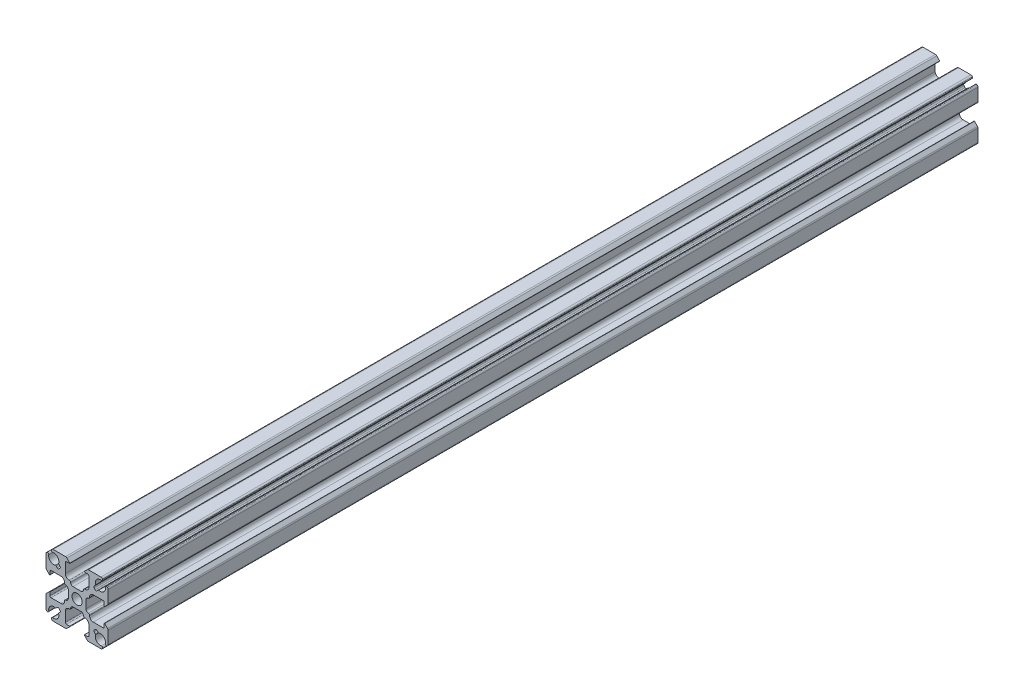
from build123d import *

# Parameters (mm, degrees)
SKETCH1_R                           = 2.08
BOSS_EXTRUDE1_DEPTH                 = 177.8
SKETCH2_W                           = 3.2
SKETCH2_H                           = 16.3
F_6_4_6_4_DIAMETER_HOLE1_AT_2_COUNT = 2
F_6_4_6_4_DIAMETER_HOLE1_AT_2_PITCH = 120
F_6_4_6_4_DIAMETER_HOLE1_AT_3_COUNT = 2
F_6_4_6_4_DIAMETER_HOLE1_AT_3_PITCH = 240


with BuildPart() as part:
    # Sketch1 → Boss-Extrude1 (new, symmetric)
    with BuildSketch(Plane(origin=(0, 0, 0), x_dir=(-1, 0, 0), z_dir=(0, 0, -1))):
        with BuildLine():
            Line((-7.48853247, 8.61990332), (-6.985643798, 8.117014648))
            ThreePointArc((-6.985643798, 8.117014648), (-6.839197188, 7.763461257), (-6.985643798, 7.409907866))
            Line((-6.985643798, 7.409907866), (-7.409907866, 6.985643798))
            ThreePointArc((-7.409907866, 6.985643798), (-7.763461257, 6.839197188), (-8.117014648, 6.985643798))
            Line((-8.117014648, 6.985643798), (-8.61990332, 7.48853247))
            ThreePointArc((-8.61990332, 7.48853247), (-8.738774884, 7.554957329), (-8.874825936, 7.549228331))
            ThreePointArc((-8.874825936, 7.549228331), (-10.889377278, 7.955008076), (-11.572136222, 9.893284252))
            ThreePointArc((-11.572136222, 9.893284252), (-11.766795458, 10.383720777), (-12.292708824, 10.42656157))
            ThreePointArc((-12.292708824, 10.42656157), (-12.590129525, 10.150252615), (-12.7, 9.759440396))
            Line((-12.7, 9.759440396), (-12.7, 4.710660172))
            ThreePointArc((-12.7, 4.710660172), (-12.642909649, 4.423647598), (-12.480330086, 4.180330086))
            Line((-12.480330086, 4.180330086), (-11.270710678, 2.970710678))
            ThreePointArc((-11.270710678, 2.970710678), (-11.161731657, 2.949033403), (-11.1, 3.041421356))
            Line((-11.1, 3.041421356), (-11.1, 4.325))
            ThreePointArc((-11.1, 4.325), (-10.953553391, 4.678553391), (-10.6, 4.825))
            Line((-10.6, 4.825), (-6.6, 4.825))
            ThreePointArc((-6.6, 4.825), (-5.539339828, 4.385660172), (-5.1, 3.325))
            Line((-5.1, 3.325), (-5.1, 3.15))
            ThreePointArc((-5.1, 3.15), (-4.953553391, 2.796446609), (-4.6, 2.65))
            ThreePointArc((-4.6, 2.65), (-3.892893219, 2.357106781), (-3.6, 1.65))
            Line((-3.6, 1.65), (-3.6, -1.65))
            ThreePointArc((-3.6, -1.65), (-3.892893219, -2.357106781), (-4.6, -2.65))
            ThreePointArc((-4.6, -2.65), (-4.953553391, -2.796446609), (-5.1, -3.15))
            Line((-5.1, -3.15), (-5.1, -3.325))
            ThreePointArc((-5.1, -3.325), (-5.539339828, -4.385660172), (-6.6, -4.825))
            Line((-6.6, -4.825), (-10.6, -4.825))
            ThreePointArc((-10.6, -4.825), (-10.953553391, -4.678553391), (-11.1, -4.325))
            Line((-11.1, -4.325), (-11.1, -3.041421356))
            ThreePointArc((-11.1, -3.041421356), (-11.161731657, -2.949033403), (-11.270710678, -2.970710678))
            Line((-11.270710678, -2.970710678), (-12.480330086, -4.180330086))
            ThreePointArc((-12.480330086, -4.180330086), (-12.642909649, -4.423647598), (-12.7, -4.710660172))
            Line((-12.7, -4.710660172), (-12.7, -9.759440396))
            ThreePointArc((-12.7, -9.759440396), (-12.590129525, -10.150252615), (-12.292708824, -10.42656157))
            ThreePointArc((-12.292708824, -10.42656157), (-11.766795458, -10.383720777), (-11.572136222, -9.893284252))
            ThreePointArc((-11.572136222, -9.893284252), (-10.889377278, -7.955008076), (-8.874825936, -7.549228331))
            ThreePointArc((-8.874825936, -7.549228331), (-8.738774884, -7.554957329), (-8.61990332, -7.48853247))
            Line((-8.61990332, -7.48853247), (-8.117014648, -6.985643798))
            ThreePointArc((-8.117014648, -6.985643798), (-7.763461257, -6.839197188), (-7.409907866, -6.985643798))
            Line((-7.409907866, -6.985643798), (-6.985643798, -7.409907866))
            ThreePointArc((-6.985643798, -7.409907866), (-6.839197188, -7.763461257), (-6.985643798, -8.117014648))
            Line((-6.985643798, -8.117014648), (-7.48853247, -8.61990332))
            ThreePointArc((-7.48853247, -8.61990332), (-7.554957329, -8.738774884), (-7.549228331, -8.874825936))
            ThreePointArc((-7.549228331, -8.874825936), (-7.955008076, -10.889377278), (-9.893284252, -11.572136222))
            ThreePointArc((-9.893284252, -11.572136222), (-10.383720777, -11.766795458), (-10.42656157, -12.292708824))
            ThreePointArc((-10.42656157, -12.292708824), (-10.150252615, -12.590129525), (-9.759440396, -12.7))
            Line((-9.759440396, -12.7), (-4.710660172, -12.7))
            ThreePointArc((-4.710660172, -12.7), (-4.423647598, -12.642909649), (-4.180330086, -12.480330086))
            Line((-4.180330086, -12.480330086), (-2.970710678, -11.270710678))
            ThreePointArc((-2.970710678, -11.270710678), (-2.949033403, -11.161731657), (-3.041421356, -11.1))
            Line((-3.041421356, -11.1), (-4.325, -11.1))
            ThreePointArc((-4.325, -11.1), (-4.678553391, -10.953553391), (-4.825, -10.6))
            Line((-4.825, -10.6), (-4.825, -6.6))
            ThreePointArc((-4.825, -6.6), (-4.385660172, -5.539339828), (-3.325, -5.1))
            Line((-3.325, -5.1), (-3.15, -5.1))
            ThreePointArc((-3.15, -5.1), (-2.796446609, -4.953553391), (-2.65, -4.6))
            ThreePointArc((-2.65, -4.6), (-2.357106781, -3.892893219), (-1.65, -3.6))
            Line((-1.65, -3.6), (1.65, -3.6))
            ThreePointArc((1.65, -3.6), (2.357106781, -3.892893219), (2.65, -4.6))
            ThreePointArc((2.65, -4.6), (2.796446609, -4.953553391), (3.15, -5.1))
            Line((3.15, -5.1), (3.325, -5.1))
            ThreePointArc((3.325, -5.1), (4.385660172, -5.539339828), (4.825, -6.6))
            Line((4.825, -6.6), (4.825, -10.6))
            ThreePointArc((4.825, -10.6), (4.678553391, -10.953553391), (4.325, -11.1))
            Line((4.325, -11.1), (3.041421356, -11.1))
            ThreePointArc((3.041421356, -11.1), (2.949033403, -11.161731657), (2.970710678, -11.270710678))
            Line((2.970710678, -11.270710678), (4.180330086, -12.480330086))
            ThreePointArc((4.180330086, -12.480330086), (4.423647598, -12.642909649), (4.710660172, -12.7))
            Line((4.710660172, -12.7), (9.759440396, -12.7))
            ThreePointArc((9.759440396, -12.7), (10.150252615, -12.590129525), (10.42656157, -12.292708824))
            ThreePointArc((10.42656157, -12.292708824), (10.383720777, -11.766795458), (9.893284252, -11.572136222))
            ThreePointArc((9.893284252, -11.572136222), (7.955008076, -10.889377278), (7.549228331, -8.874825936))
            ThreePointArc((7.549228331, -8.874825936), (7.554957329, -8.738774884), (7.48853247, -8.61990332))
            Line((7.48853247, -8.61990332), (6.985643798, -8.117014648))
            ThreePointArc((6.985643798, -8.117014648), (6.839197188, -7.763461257), (6.985643798, -7.409907866))
            Line((6.985643798, -7.409907866), (7.409907866, -6.985643798))
            ThreePointArc((7.409907866, -6.985643798), (7.763461257, -6.839197188), (8.117014648, -6.985643798))
            Line((8.117014648, -6.985643798), (8.61990332, -7.48853247))
            ThreePointArc((8.61990332, -7.48853247), (8.738774884, -7.554957329), (8.874825936, -7.549228331))
            ThreePointArc((8.874825936, -7.549228331), (10.889377278, -7.955008076), (11.572136222, -9.893284252))
            ThreePointArc((11.572136222, -9.893284252), (11.766795458, -10.383720777), (12.292708824, -10.42656157))
            ThreePointArc((12.292708824, -10.42656157), (12.590129525, -10.150252615), (12.7, -9.759440396))
            Line((12.7, -9.759440396), (12.7, -4.710660172))
            ThreePointArc((12.7, -4.710660172), (12.642909649, -4.423647598), (12.480330086, -4.180330086))
            Line((12.480330086, -4.180330086), (11.270710678, -2.970710678))
            ThreePointArc((11.270710678, -2.970710678), (11.161731657, -2.949033403), (11.1, -3.041421356))
            Line((11.1, -3.041421356), (11.1, -4.325))
            ThreePointArc((11.1, -4.325), (10.953553391, -4.678553391), (10.6, -4.825))
            Line((10.6, -4.825), (6.6, -4.825))
            ThreePointArc((6.6, -4.825), (5.539339828, -4.385660172), (5.1, -3.325))
            Line((5.1, -3.325), (5.1, -3.15))
            ThreePointArc((5.1, -3.15), (4.953553391, -2.796446609), (4.6, -2.65))
            ThreePointArc((4.6, -2.65), (3.892893219, -2.357106781), (3.6, -1.65))
            Line((3.6, -1.65), (3.6, 1.65))
            ThreePointArc((3.6, 1.65), (3.892893219, 2.357106781), (4.6, 2.65))
            ThreePointArc((4.6, 2.65), (4.953553391, 2.796446609), (5.1, 3.15))
            Line((5.1, 3.15), (5.1, 3.325))
            ThreePointArc((5.1, 3.325), (5.539339828, 4.385660172), (6.6, 4.825))
            Line((6.6, 4.825), (10.6, 4.825))
            ThreePointArc((10.6, 4.825), (10.953553391, 4.678553391), (11.1, 4.325))
            Line((11.1, 4.325), (11.1, 3.041421356))
            ThreePointArc((11.1, 3.041421356), (11.161731657, 2.949033403), (11.270710678, 2.970710678))
            Line((11.270710678, 2.970710678), (12.480330086, 4.180330086))
            ThreePointArc((12.480330086, 4.180330086), (12.642909649, 4.423647598), (12.7, 4.710660172))
            Line((12.7, 4.710660172), (12.7, 9.759440396))
            ThreePointArc((12.7, 9.759440396), (12.590129525, 10.150252615), (12.292708824, 10.42656157))
            ThreePointArc((12.292708824, 10.42656157), (11.766795458, 10.383720777), (11.572136222, 9.893284252))
            ThreePointArc((11.572136222, 9.893284252), (10.889377278, 7.955008076), (8.874825936, 7.549228331))
            ThreePointArc((8.874825936, 7.549228331), (8.738774884, 7.554957329), (8.61990332, 7.48853247))
            Line((8.61990332, 7.48853247), (8.117014648, 6.985643798))
            ThreePointArc((8.117014648, 6.985643798), (7.763461257, 6.839197188), (7.409907866, 6.985643798))
            Line((7.409907866, 6.985643798), (6.985643798, 7.409907866))
            ThreePointArc((6.985643798, 7.409907866), (6.839197188, 7.763461257), (6.985643798, 8.117014648))
            Line((6.985643798, 8.117014648), (7.48853247, 8.61990332))
            ThreePointArc((7.48853247, 8.61990332), (7.554957329, 8.738774884), (7.549228331, 8.874825936))
            ThreePointArc((7.549228331, 8.874825936), (7.955008076, 10.889377278), (9.893284252, 11.572136222))
            ThreePointArc((9.893284252, 11.572136222), (10.383720777, 11.766795458), (10.42656157, 12.292708824))
            ThreePointArc((10.42656157, 12.292708824), (10.150252615, 12.590129525), (9.759440396, 12.7))
            Line((9.759440396, 12.7), (4.710660172, 12.7))
            ThreePointArc((4.710660172, 12.7), (4.423647598, 12.642909649), (4.180330086, 12.480330086))
            Line((4.180330086, 12.480330086), (2.970710678, 11.270710678))
            ThreePointArc((2.970710678, 11.270710678), (2.949033403, 11.161731657), (3.041421356, 11.1))
            Line((3.041421356, 11.1), (4.325, 11.1))
            ThreePointArc((4.325, 11.1), (4.678553391, 10.953553391), (4.825, 10.6))
            Line((4.825, 10.6), (4.825, 6.6))
            ThreePointArc((4.825, 6.6), (4.385660172, 5.539339828), (3.325, 5.1))
            Line((3.325, 5.1), (3.15, 5.1))
            ThreePointArc((3.15, 5.1), (2.796446609, 4.953553391), (2.65, 4.6))
            ThreePointArc((2.65, 4.6), (2.357106781, 3.892893219), (1.65, 3.6))
            Line((1.65, 3.6), (-1.65, 3.6))
            ThreePointArc((-1.65, 3.6), (-2.357106781, 3.892893219), (-2.65, 4.6))
            ThreePointArc((-2.65, 4.6), (-2.796446609, 4.953553391), (-3.15, 5.1))
            Line((-3.15, 5.1), (-3.325, 5.1))
            ThreePointArc((-3.325, 5.1), (-4.385660172, 5.539339828), (-4.825, 6.6))
            Line((-4.825, 6.6), (-4.825, 10.6))
            ThreePointArc((-4.825, 10.6), (-4.678553391, 10.953553391), (-4.325, 11.1))
            Line((-4.325, 11.1), (-3.041421356, 11.1))
            ThreePointArc((-3.041421356, 11.1), (-2.949033403, 11.161731657), (-2.970710678, 11.270710678))
            Line((-2.970710678, 11.270710678), (-4.180330086, 12.480330086))
            ThreePointArc((-4.180330086, 12.480330086), (-4.423647598, 12.642909649), (-4.710660172, 12.7))
            Line((-4.710660172, 12.7), (-9.759440396, 12.7))
            ThreePointArc((-9.759440396, 12.7), (-10.150252615, 12.590129525), (-10.42656157, 12.292708824))
            ThreePointArc((-10.42656157, 12.292708824), (-10.383720777, 11.766795458), (-9.893284252, 11.572136222))
            ThreePointArc((-9.893284252, 11.572136222), (-7.955008076, 10.889377278), (-7.549228331, 8.874825936))
            ThreePointArc((-7.549228331, 8.874825936), (-7.554957329, 8.738774884), (-7.48853247, 8.61990332))
        make_face()
        Circle(SKETCH1_R, mode=Mode.SUBTRACT)
    extrude(amount=BOSS_EXTRUDE1_DEPTH, both=True)

    # Sketch2 → Ø6.4 (6.4) Diameter Hole1 (revolve, cut)
    with BuildSketch(Plane(origin=(3.6, 0, 137.79999999), x_dir=(0, 0, -1), z_dir=(0, 1, 0))):
        with Locations((1.6, 8.15)):
            Rectangle(SKETCH2_W, SKETCH2_H)
    f_6_4_6_4_diameter_hole1 = revolve(axis=Axis((9.95, 0, 137.79999999), (-1, 0, 0)), mode=Mode.SUBTRACT)

    # Ø6.4 (6.4) Diameter Hole1 at 2: Ø6.4 (6.4) Diameter Hole1 ×2
    with Locations(*[(0, 0, -i * F_6_4_6_4_DIAMETER_HOLE1_AT_2_PITCH) for i in range(1, F_6_4_6_4_DIAMETER_HOLE1_AT_2_COUNT)]):
        add(f_6_4_6_4_diameter_hole1, mode=Mode.SUBTRACT)

    # Ø6.4 (6.4) Diameter Hole1 at 3: Ø6.4 (6.4) Diameter Hole1 ×2
    with Locations(*[(0, 0, -i * F_6_4_6_4_DIAMETER_HOLE1_AT_3_PITCH) for i in range(1, F_6_4_6_4_DIAMETER_HOLE1_AT_3_COUNT)]):
        add(f_6_4_6_4_diameter_hole1, mode=Mode.SUBTRACT)


solid = part.part
